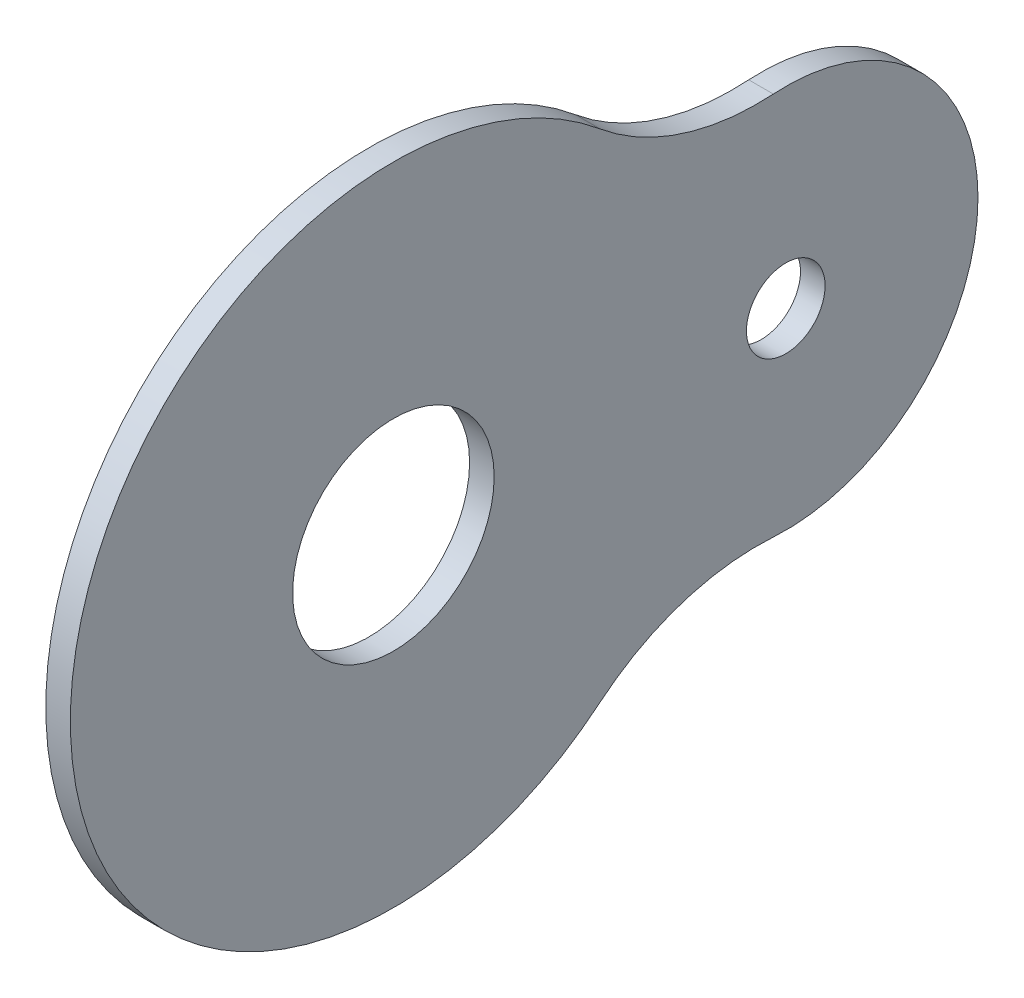
from build123d import *

# Parameters (mm, degrees)
SKETCH_1_R      = 1.6
SKETCH_1_R_2    = 4.1
EXTRUDE_1_DEPTH = 1
FILLET_1_R      = 10


with BuildPart() as part:
    # Эскиз1 → Бобышка-Вытянуть1 (new body)
    with BuildSketch(Plane(origin=(0, 0, 0), x_dir=(0, 0, -1), z_dir=(1, 0, 0))):
        with BuildLine():
            ThreePointArc((11.473333333, -6.404859266), (23.78, 0), (11.473333333, 6.404859266))
            ThreePointArc((11.473333333, 6.404859266), (-13.14, 0), (11.473333333, -6.404859266))
        make_face()
        with Locations((15.96, 0)):
            Circle(SKETCH_1_R, mode=Mode.SUBTRACT)
        Circle(SKETCH_1_R_2, mode=Mode.SUBTRACT)
    extrude(amount=EXTRUDE_1_DEPTH)

    # Скругление1
    fillet_1_edges = [part.edges().sort_by_distance(p)[0] for p in [
        (0.5, -6.404859266, -11.473333333),
        (0.5, 6.404859266, -11.473333333),
    ]]
    fillet(fillet_1_edges, radius=FILLET_1_R)


solid = part.part
